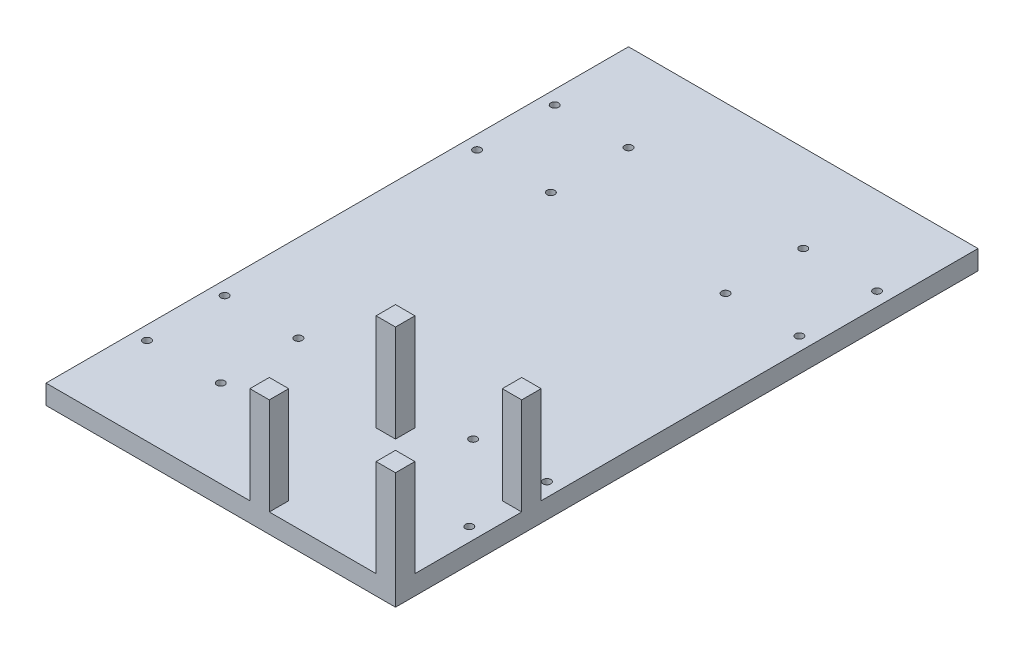
from build123d import *

# Parameters (mm, degrees)
SKETCH3_W           = 180
SKETCH3_H           = 300
BOSS_EXTRUDE1_DEPTH = 10
SKETCH4_W           = 10
SKETCH4_H           = 10
BOSS_EXTRUDE2_DEPTH = 50
SKETCH7_R           = 2
CUT_EXTRUDE2_DEPTH  = 10


with BuildPart() as part:
    # Sketch3 → Boss-Extrude1 (new body)
    with BuildSketch(Plane(origin=(0, 0, 0), x_dir=(1, 0, 0), z_dir=(0, 1, 0))):
        Rectangle(SKETCH3_W, SKETCH3_H)
    extrude(amount=BOSS_EXTRUDE1_DEPTH)

    # Sketch4 → Boss-Extrude2 (add)
    with BuildSketch(Plane(origin=(0, 10, 0), x_dir=(1, 0, 0), z_dir=(0, 1, 0))):
        with Locations((85, -145)):
            Rectangle(SKETCH4_W, SKETCH4_H)
        with Locations((85, -80)):
            Rectangle(SKETCH4_W, SKETCH4_H)
        with Locations((20, -145)):
            Rectangle(SKETCH4_W, SKETCH4_H)
        with Locations((20, -80)):
            Rectangle(SKETCH4_W, SKETCH4_H)
    extrude(amount=BOSS_EXTRUDE2_DEPTH)

    # Sketch7 → Cut-Extrude2 (cut)
    with BuildSketch(Plane.XZ):
        with Locations((45, -105)):
            Circle(SKETCH7_R)
        with Locations((83, -105)):
            Circle(SKETCH7_R)
        with Locations((83, -65)):
            Circle(SKETCH7_R)
        with Locations((45, -65)):
            Circle(SKETCH7_R)
        with Locations((-45, -65)):
            Circle(SKETCH7_R)
        with Locations((-83, -65)):
            Circle(SKETCH7_R)
        with Locations((-45, -105)):
            Circle(SKETCH7_R)
        with Locations((-83, -105)):
            Circle(SKETCH7_R)
        with Locations((-83, 65)):
            Circle(SKETCH7_R)
        with Locations((-83, 105)):
            Circle(SKETCH7_R)
        with Locations((-45, 105)):
            Circle(SKETCH7_R)
        with Locations((-45, 65)):
            Circle(SKETCH7_R)
        with Locations((45, 105)):
            Circle(SKETCH7_R)
        with Locations((83, 105)):
            Circle(SKETCH7_R)
        with Locations((83, 65)):
            Circle(SKETCH7_R)
        with Locations((45, 65)):
            Circle(SKETCH7_R)
    extrude(amount=-CUT_EXTRUDE2_DEPTH, mode=Mode.SUBTRACT)


solid = part.part
